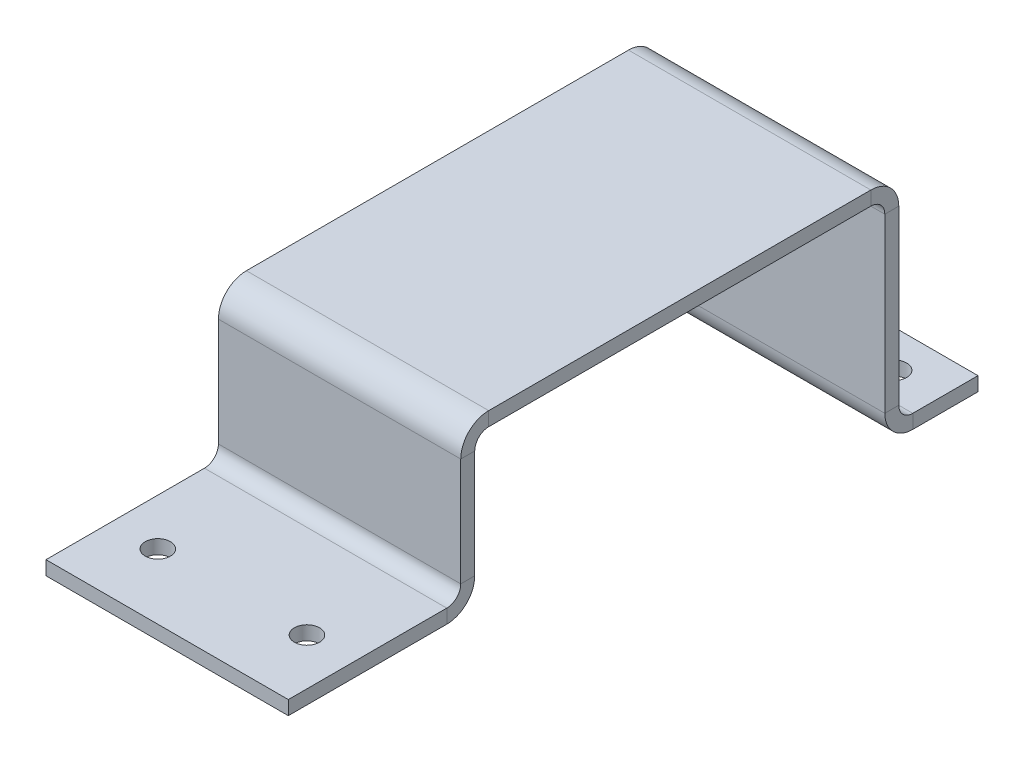
from build123d import *

# Parameters (mm, degrees)
SKETCH_1_W                       = 26
SKETCH_1_H                       = 10
SKETCH_1_R                       = 1.35
EXTRUDE_1_DEPTH                  = 1.5
SM_EDGE_FLANGE_1_STRIP_W         = 9
SM_EDGE_FLANGE_1_STRIP_H         = 1.5
SM_EDGE_FLANGE_1_STRIP_CUT_DEPTH = 26
SM_EDGE_FLANGE_1_DEPTH           = 26
SM_EDGE_FLANGE_2_STRIP_W         = 9
SM_EDGE_FLANGE_2_STRIP_H         = 1.5
SM_EDGE_FLANGE_2_STRIP_CUT_DEPTH = 26
SM_EDGE_FLANGE_2_DEPTH           = 26
SM_EDGE_FLANGE_3_STRIP_W         = 9
SM_EDGE_FLANGE_3_STRIP_H         = 1.5
SM_EDGE_FLANGE_3_STRIP_CUT_DEPTH = 26
SM_EDGE_FLANGE_3_DEPTH           = 26
SM_EDGE_FLANGE_4_STRIP_W         = 9
SM_EDGE_FLANGE_4_STRIP_H         = 1.5
SM_EDGE_FLANGE_4_STRIP_CUT_DEPTH = 26
SM_EDGE_FLANGE_4_DEPTH           = 26
SKETCH_22_R                      = 1.35
CUT_EXTRUDE_1_DEPTH              = 1.5


# Sheet-metal steps are written as plain solids
with BuildPart() as part:
    # Sketch 1 → Бобышка-Вытянуть1 (new body)
    with BuildSketch(Plane(origin=(0, 0, 0), x_dir=(1, 0, 0), z_dir=(0, 1, 0))):
        with Locations((13, 5)):
            Rectangle(SKETCH_1_W, SKETCH_1_H)
        with Locations(Location((5, 6, 0), (0, 0, 270))):
            Circle(SKETCH_1_R, mode=Mode.SUBTRACT)
        with Locations(Location((21, 6, 0), (0, 0, 270))):
            Circle(SKETCH_1_R, mode=Mode.SUBTRACT)
    extrude(amount=EXTRUDE_1_DEPTH)

    # Ребро-кромка1 strip (across the edge) → Ребро-кромка1 strip cut (cut)
    with BuildSketch(Plane(origin=(0, 1.5, 0), x_dir=(0, 0, -1), z_dir=(1, 0, 0))):
        with Locations((-1.5, -0.75)):
            Rectangle(SM_EDGE_FLANGE_1_STRIP_W, SM_EDGE_FLANGE_1_STRIP_H)
    extrude(amount=SM_EDGE_FLANGE_1_STRIP_CUT_DEPTH, mode=Mode.SUBTRACT)

    # Ребро-кромка1 section (across the edge) → Ребро-кромка1 (add)
    with BuildSketch(Plane(origin=(0, 1.5, 0), x_dir=(0, 0, -1), z_dir=(1, 0, 0))):
        with BuildLine():
            Line((0, 1.5), (0, 23))
            Line((0, 23), (1.5, 23))
            Line((1.5, 23), (1.5, 1.5))
            ThreePointArc((1.5, 1.5), (1.939339828, 0.439339828), (3, 0))
            Line((3, 0), (3, -1.5))
            ThreePointArc((3, -1.5), (0.878679656, -0.621320344), (0, 1.5))
        make_face()
    extrude(amount=SM_EDGE_FLANGE_1_DEPTH)

    # Ребро-кромка2 strip (across the edge) → Ребро-кромка2 strip cut (cut)
    with BuildSketch(Plane(origin=(26, 24.5, 0), x_dir=(0, -1, 0), z_dir=(-1, 0, 0))):
        with Locations((-1.5, -0.75)):
            Rectangle(SM_EDGE_FLANGE_2_STRIP_W, SM_EDGE_FLANGE_2_STRIP_H)
    extrude(amount=SM_EDGE_FLANGE_2_STRIP_CUT_DEPTH, mode=Mode.SUBTRACT)

    # Ребро-кромка2 section (across the edge) → Ребро-кромка2 (add)
    with BuildSketch(Plane(origin=(26, 24.5, 0), x_dir=(0, -1, 0), z_dir=(-1, 0, 0))):
        with BuildLine():
            Line((0, 1.5), (0, 45.5))
            Line((0, 45.5), (1.5, 45.5))
            Line((1.5, 45.5), (1.5, 1.5))
            ThreePointArc((1.5, 1.5), (1.939339828, 0.439339828), (3, 0))
            Line((3, 0), (3, -1.5))
            ThreePointArc((3, -1.5), (0.878679656, -0.621320344), (0, 1.5))
        make_face()
    extrude(amount=SM_EDGE_FLANGE_2_DEPTH)

    # Ребро-кромка3 strip (across the edge) → Ребро-кромка3 strip cut (cut)
    with BuildSketch(Plane(origin=(26, 23, 45.5), x_dir=(0, 0, -1), z_dir=(-1, 0, 0))):
        with Locations((-1.5, -0.75)):
            Rectangle(SM_EDGE_FLANGE_3_STRIP_W, SM_EDGE_FLANGE_3_STRIP_H)
    extrude(amount=SM_EDGE_FLANGE_3_STRIP_CUT_DEPTH, mode=Mode.SUBTRACT)

    # Ребро-кромка3 section (across the edge) → Ребро-кромка3 (add)
    with BuildSketch(Plane(origin=(26, 23, 45.5), x_dir=(0, 0, -1), z_dir=(-1, 0, 0))):
        with BuildLine():
            Line((0, 1.5), (0, 16.1))
            Line((0, 16.1), (1.5, 16.1))
            Line((1.5, 16.1), (1.5, 1.5))
            ThreePointArc((1.5, 1.5), (1.939339828, 0.439339828), (3, 0))
            Line((3, 0), (3, -1.5))
            ThreePointArc((3, -1.5), (0.878679656, -0.621320344), (0, 1.5))
        make_face()
    extrude(amount=SM_EDGE_FLANGE_3_DEPTH)

    # Ребро-кромка4 strip (across the edge) → Ребро-кромка4 strip cut (cut)
    with BuildSketch(Plane(origin=(0, 6.9, 45.5), x_dir=(0, 1, 0), z_dir=(1, 0, 0))):
        with Locations((-1.5, -0.75)):
            Rectangle(SM_EDGE_FLANGE_4_STRIP_W, SM_EDGE_FLANGE_4_STRIP_H)
    extrude(amount=SM_EDGE_FLANGE_4_STRIP_CUT_DEPTH, mode=Mode.SUBTRACT)

    # Ребро-кромка4 section (across the edge) → Ребро-кромка4 (add)
    with BuildSketch(Plane(origin=(0, 6.9, 45.5), x_dir=(0, 1, 0), z_dir=(1, 0, 0))):
        with BuildLine():
            Line((0, 1.5), (0, 18.5))
            Line((0, 18.5), (1.5, 18.5))
            Line((1.5, 18.5), (1.5, 1.5))
            ThreePointArc((1.5, 1.5), (1.939339828, 0.439339828), (3, 0))
            Line((3, 0), (3, -1.5))
            ThreePointArc((3, -1.5), (0.878679656, -0.621320344), (0, 1.5))
        make_face()
    extrude(amount=SM_EDGE_FLANGE_4_DEPTH)

    # Эскиз22 → Вырез-Вытянуть1 (cut)
    with BuildSketch(Plane(origin=(0, 8.4, 0), x_dir=(1, 0, 0), z_dir=(0, 1, 0))):
        with Locations(Location((5, -57, 0), (0, 0, 270))):
            Circle(SKETCH_22_R)
        with Locations(Location((21, -57, 0), (0, 0, 270))):
            Circle(SKETCH_22_R)
    extrude(amount=-CUT_EXTRUDE_1_DEPTH, mode=Mode.SUBTRACT)


solid = part.part
